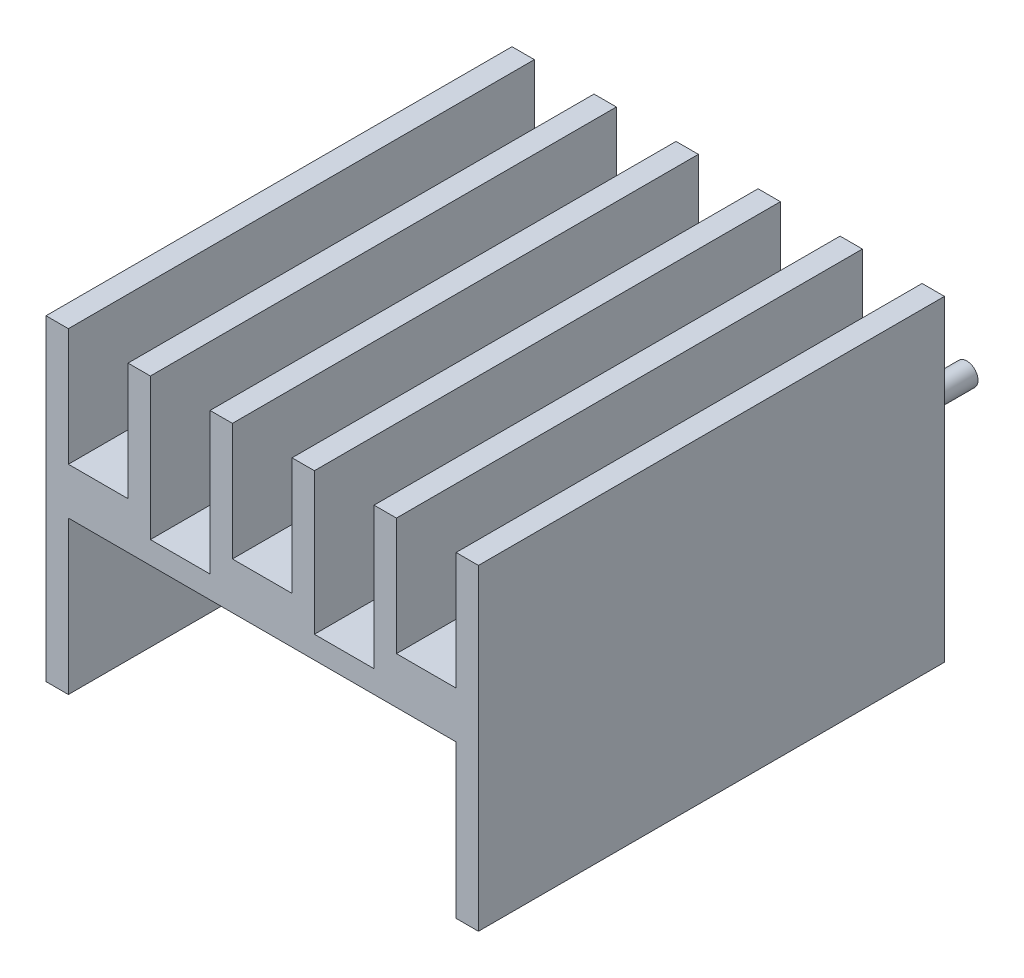
from build123d import *

# Parameters (mm, degrees)
EXTRUDE_1_DEPTH = 25
SKETCH_2_R      = 0.6
EXTRUDE_2_DEPTH = 4


with BuildPart() as part:
    # 草图1 → 凸台-拉伸1 (new body)
    with BuildSketch(Plane.XY):
        Polygon((-11.6, 8.8), (-11.6, -8.2), (-10.4, -8.2), (-10.4, 0), (10.4, 0), (10.4, -8.2), (11.6, -8.2), (11.6, 8.8), (10.4, 8.8), (10.4, 2.5), (7.2, 2.5), (7.2, 8.8), (6, 8.8), (6, 1.2), (2.8, 1.2), (2.8, 8.8), (1.6, 8.8), (1.6, 2.5), (-1.6, 2.5), (-1.6, 8.8), (-2.8, 8.8), (-2.8, 1.2), (-6, 1.2), (-6, 8.8), (-7.2, 8.8), (-7.2, 2.5), (-10.4, 2.5), (-10.4, 8.8), align=None)
    extrude(amount=EXTRUDE_1_DEPTH)

    # 草图2 → 凸台-拉伸2 (add)
    with BuildSketch(Plane(origin=(0, 0, 0), x_dir=(-1, 0, 0), z_dir=(0, 0, -1))):
        with Locations((-8.8, 1.8)):
            Circle(SKETCH_2_R)
        with Locations((8.8, 1.8)):
            Circle(SKETCH_2_R)
    extrude(amount=EXTRUDE_2_DEPTH)


solid = part.part
